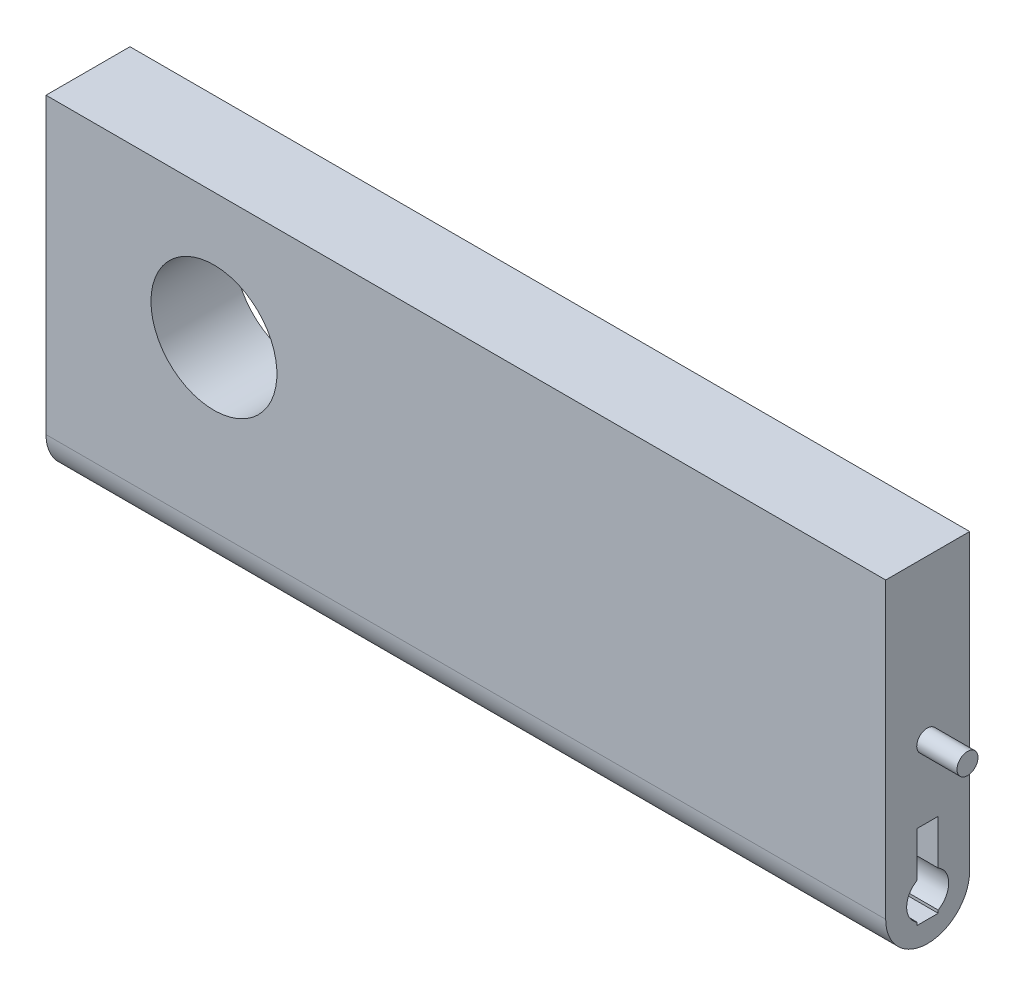
from build123d import *

# Parameters (mm, degrees)
SKETCH1_W           = 63.5
SKETCH1_H           = 25.4
BOSS_EXTRUDE1_DEPTH = 6.35
SKETCH3_R           = 1.5875
CUT_EXTRUDE2_DEPTH  = 66.068137364
FILLET1_R           = 3.175
SKETCH4_R           = 4.7625
CUT_EXTRUDE3_DEPTH  = 38.701036126
SKETCH5_W           = 1.5875
SKETCH5_H           = 6.35
CUT_EXTRUDE4_DEPTH  = 3.175
SKETCH6_R           = 0.79375
BOSS_EXTRUDE2_DEPTH = 3.048


with BuildPart() as part:
    # Sketch1 → Boss-Extrude1 (new body)
    with BuildSketch(Plane.XY):
        with Locations((-3.175, 0)):
            Rectangle(SKETCH1_W, SKETCH1_H)
    extrude(amount=BOSS_EXTRUDE1_DEPTH)

    # Sketch3 → Cut-Extrude2 (cut, through all)
    with BuildSketch(Plane(origin=(28.575, 0, 6.35), x_dir=(0, 0, -1), z_dir=(1, 0, 0))):
        with Locations((3.175, -9.525)):
            Circle(SKETCH3_R)
    extrude(amount=-CUT_EXTRUDE2_DEPTH, mode=Mode.SUBTRACT)

    # Fillet1
    fillet1_edges = [part.edges().sort_by_distance(p)[0] for p in [
        (-3.175, -12.7, 0),
        (-3.175, -12.7, 6.35),
    ]]
    fillet(fillet1_edges, radius=FILLET1_R - 0.0001)  # a hair under: the kernel refuses the full size

    # Sketch4 → Cut-Extrude3 (cut, through all)
    with BuildSketch(Plane(origin=(0, 0, 0), x_dir=(-1, 0, 0), z_dir=(0, 0, -1))):
        with Locations((22.225, 3.175)):
            Circle(SKETCH4_R)
    extrude(amount=-CUT_EXTRUDE3_DEPTH, mode=Mode.SUBTRACT)

    # Sketch5 → Cut-Extrude4 (cut)
    with BuildSketch(Plane(origin=(28.575, 0, 0), x_dir=(0, 0, -1), z_dir=(1, 0, 0))):
        with Locations((-3.175, -7.9375)):
            Rectangle(SKETCH5_W, SKETCH5_H)
    extrude(amount=-CUT_EXTRUDE4_DEPTH, mode=Mode.SUBTRACT)

    # Sketch6 → Boss-Extrude2 (add)
    with BuildSketch(Plane(origin=(28.575, 0, 0), x_dir=(0, 0, -1), z_dir=(1, 0, 0))):
        with Locations(Location((-3.209540098, 0.635, 0), (0, 0, 180))):
            Circle(SKETCH6_R)
    extrude(amount=BOSS_EXTRUDE2_DEPTH)


solid = part.part
